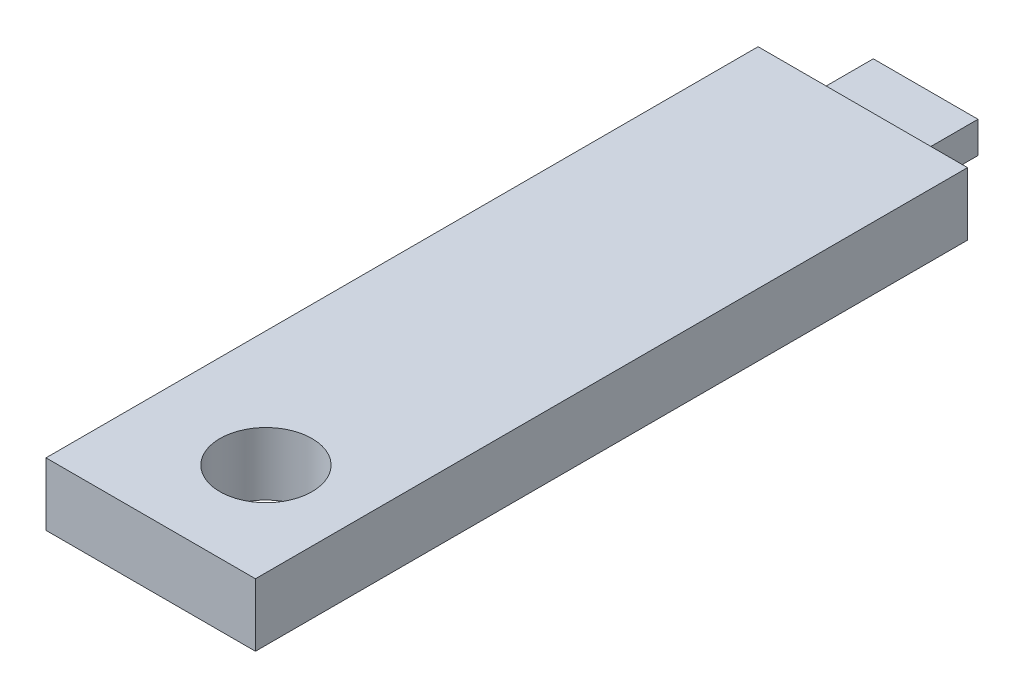
from build123d import *

# Parameters (mm, degrees)
SKETCH1_W           = 5
SKETCH1_H           = 1.5
BOSS_EXTRUDE1_DEPTH = 3
SKETCH2_W           = 10
SKETCH2_H           = 3
BOSS_EXTRUDE2_DEPTH = 34
SKETCH3_R           = 2.2
CUT_EXTRUDE1_DEPTH  = 38.871493237


with BuildPart() as part:
    # Sketch1 → Boss-Extrude1 (new body)
    with BuildSketch(Plane.XY):
        with Locations((2.5, 0.75)):
            Rectangle(SKETCH1_W, SKETCH1_H)
    extrude(amount=BOSS_EXTRUDE1_DEPTH)

    # Sketch2 → Boss-Extrude2 (add)
    with BuildSketch(Plane.XY.offset(3)):
        with Locations((2.5, 0.75)):
            Rectangle(SKETCH2_W, SKETCH2_H)
    extrude(amount=BOSS_EXTRUDE2_DEPTH)

    # Sketch3 → Cut-Extrude1 (cut, through all)
    with BuildSketch(Plane.XZ.offset(0.75)):
        with Locations((3.052066799, 32.049883395)):
            Circle(SKETCH3_R)
    extrude(amount=-CUT_EXTRUDE1_DEPTH, mode=Mode.SUBTRACT)


solid = part.part
